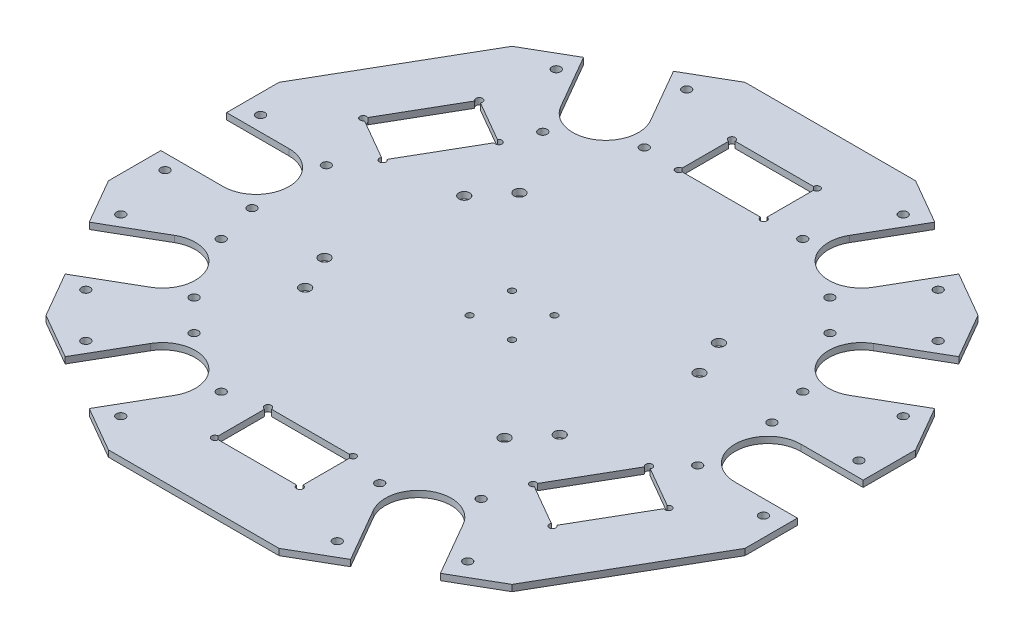
from build123d import *

# Parameters (mm, degrees)
BOSS_EXTRUDE1_DEPTH = 3
SKETCH2_R           = 2.05
HEXCUT1_DEPTH       = 3
SKETCH6_R           = 2.05
QUADCUT1_DEPTH      = 3
CUT_EXTRUDE3_DEPTH  = 3
CUT_EXTRUDE4_DEPTH  = 3
SKETCH10_R          = 2.55
HEXBATHOLES_DEPTH   = 3
SKETCH11_R          = 2.55
QUADBATHOLES_DEPTH  = 3
SKETCH13_R          = 1.55
PDBHOLES_DEPTH      = 3
SKETCH15_R          = 1.55
SKETCH15_W          = 40
SKETCH15_H          = 25
CUT_EXTRUDE8_DEPTH  = 3
ACCESSHOLES_DEPTH   = 3


# Read off the part's stored shape, not the designer's step: AccessHoles
with BuildPart() as part:
    # Sketch1 → Boss-Extrude1 (new body)
    with BuildSketch(Plane(origin=(0, 0, 0), x_dir=(1, 0, 0), z_dir=(0, 1, 0))):
        Polygon((150, -40.192378865), (150, 40.192378865), (109.807621135, 109.807621135), (40.192378865, 150), (-40.192378865, 150), (-109.807621135, 109.807621135), (-150, 40.192378865), (-150, -40.192378865), (-109.807621135, -109.807621135), (-40.192378865, -150), (40.192378865, -150), (109.807621135, -109.807621135), align=None)
    extrude(amount=BOSS_EXTRUDE1_DEPTH)

    # Sketch2 → HexCut1 (cut)
    with BuildSketch(Plane(origin=(0, 3, 0), x_dir=(1, 0, 0), z_dir=(0, 1, 0))):
        with Locations(Location((51.014428415, 133.359581934, 0), (0, 0, 270))):
            Circle(SKETCH2_R)
        with Locations(Location((37.344555434, 99.682667397, 0), (0, 0, 270))):
            Circle(SKETCH2_R)
        with Locations(Location((37.344555434, -99.682667397, 0), (0, 0, 270))):
            Circle(SKETCH2_R)
        with Locations(Location((51.014428415, -133.359581934, 0), (0, 0, 270))):
            Circle(SKETCH2_R)
        with Locations(Location((105, 17.5, 0), (0, 0, 270))):
            Circle(SKETCH2_R)
        with Locations(Location((141, 22.5, 0), (0, 0, 270))):
            Circle(SKETCH2_R)
        with Locations(Location((105, -17.5, 0), (0, 0, 270))):
            Circle(SKETCH2_R)
        with Locations(Location((141, -22.5, 0), (0, 0, 270))):
            Circle(SKETCH2_R)
        with Locations(Location((89.985571585, -110.859581934, 0), (0, 0, 270))):
            Circle(SKETCH2_R)
        with Locations(Location((67.655444566, -82.182667397, 0), (0, 0, 270))):
            Circle(SKETCH2_R)
        with Locations(Location((89.985571585, 110.859581934, 0), (0, 0, 270))):
            Circle(SKETCH2_R)
        with Locations(Location((67.655444566, 82.182667397, 0), (0, 0, 270))):
            Circle(SKETCH2_R)
    hexcut1 = extrude(amount=-HEXCUT1_DEPTH, mode=Mode.SUBTRACT)

    # HexCut2: HexCut1 across plane
    add(hexcut1.mirror(Plane(origin=(0, 0, 0), x_dir=(0, 0, 1), z_dir=(1, 0, 0))), mode=Mode.SUBTRACT)

    # Sketch6 → QuadCut1 (cut)
    with BuildSketch(Plane(origin=(0, 3, 0), x_dir=(1, 0, 0), z_dir=(0, 1, 0))):
        with Locations(Location((99.682667397, 37.344555434, 0), (0, 0, 270))):
            Circle(SKETCH6_R)
        with Locations(Location((133.359581934, 51.014428415, 0), (0, 0, 270))):
            Circle(SKETCH6_R)
        with Locations(Location((110.859581934, 89.985571585, 0), (0, 0, 270))):
            Circle(SKETCH6_R)
        with Locations(Location((82.182667397, 67.655444566, 0), (0, 0, 270))):
            Circle(SKETCH6_R)
    quadcut1 = extrude(amount=-QUADCUT1_DEPTH, mode=Mode.SUBTRACT)

    # Mirror1: QuadCut1 across plane
    add(quadcut1.mirror(Plane(origin=(0, 0, 0), x_dir=(0.5000000000000011, 0, 0.8660254037844378), z_dir=(0.8660254037844379, 0, -0.5000000000000012))), mode=Mode.SUBTRACT)

    # Sketch7 → Cut-Extrude3 (cut)
    with BuildSketch(Plane(origin=(0, 3, 0), x_dir=(1, 0, 0), z_dir=(0, 1, 0))):
        with BuildLine():
            Line((46.876606241, 112.192663696), (84.376606241, 177.14456898))
            Line((84.376606241, 177.14456898), (111.223393759, 161.64456898))
            Line((111.223393759, 161.64456898), (73.723393759, 96.692663696))
            ThreePointArc((73.723393759, 96.692663696), (52.55, 91.019269938), (46.876606241, 112.192663696))
        make_face()
        with BuildLine():
            Line((46.876606241, -112.192663696), (84.376606241, -177.14456898))
            Line((84.376606241, -177.14456898), (111.223393759, -161.64456898))
            Line((111.223393759, -161.64456898), (73.723393759, -96.692663696))
            ThreePointArc((73.723393759, -96.692663696), (52.55, -91.019269938), (46.876606241, -112.192663696))
        make_face()
        with BuildLine():
            Line((120.6, 15.5), (160.6, 15.5))
            Line((160.6, 15.5), (160.6, -15.5))
            Line((160.6, -15.5), (120.6, -15.5))
            ThreePointArc((120.6, -15.5), (105.1, 0), (120.6, 15.5))
        make_face()
    cut_extrude3 = extrude(amount=-CUT_EXTRUDE3_DEPTH, mode=Mode.SUBTRACT)

    # Mirror2: Cut-Extrude3 across plane
    add(cut_extrude3.mirror(Plane(origin=(0, 0, 0), x_dir=(0, 0, 1), z_dir=(1, 0, 0))), mode=Mode.SUBTRACT)

    # Sketch8 → Cut-Extrude4 (cut)
    with BuildSketch(Plane(origin=(0, 3, 0), x_dir=(1, 0, 0), z_dir=(0, 1, 0))):
        with BuildLine():
            Line((96.692663696, 73.723393759), (131.333679848, 93.723393759))
            Line((131.333679848, 93.723393759), (146.833679848, 66.876606241))
            Line((146.833679848, 66.876606241), (112.192663696, 46.876606241))
            ThreePointArc((112.192663696, 46.876606241), (91.019269938, 52.55), (96.692663696, 73.723393759))
        make_face()
    cut_extrude4 = extrude(amount=-CUT_EXTRUDE4_DEPTH, mode=Mode.SUBTRACT)

    # Mirror3: Cut-Extrude4 across plane
    add(cut_extrude4.mirror(Plane(origin=(0, 0, 0), x_dir=(0.5000000000000011, 0, 0.8660254037844378), z_dir=(0.8660254037844379, 0, -0.5000000000000012))), mode=Mode.SUBTRACT)

    # Sketch10 → HexBatHoles (cut)
    with BuildSketch(Plane(origin=(0, 3, 0), x_dir=(1, 0, 0), z_dir=(0, 1, 0))):
        with Locations(Location((60, 37.5, 0), (0, 0, 270))):
            Circle(SKETCH10_R)
        with Locations(Location((60, -37.5, 0), (0, 0, 270))):
            Circle(SKETCH10_R)
        with Locations(Location((-60, 37.5, 0), (0, 0, 270))):
            Circle(SKETCH10_R)
        with Locations(Location((-60, -37.5, 0), (0, 0, 270))):
            Circle(SKETCH10_R)
    extrude(amount=-HEXBATHOLES_DEPTH, mode=Mode.SUBTRACT)

    # Sketch11 → QuadBatHoles (cut)
    with BuildSketch(Plane(origin=(0, 3, 0), x_dir=(1, 0, 0), z_dir=(0, 1, 0))):
        with Locations(Location((67.661263769, 20.69307578, 0), (0, 0, 270))):
            Circle(SKETCH11_R)
        with Locations(Location((48.249835386, -51.751361192, 0), (0, 0, 270))):
            Circle(SKETCH11_R)
        with Locations(Location((-67.661263769, -20.69307578, 0), (0, 0, 270))):
            Circle(SKETCH11_R)
        with Locations(Location((-48.249835386, 51.751361192, 0), (0, 0, 270))):
            Circle(SKETCH11_R)
    extrude(amount=-QUADBATHOLES_DEPTH, mode=Mode.SUBTRACT)

    # Sketch13 → PDBHoles (cut)
    with BuildSketch(Plane(origin=(0, 3, 0), x_dir=(1, 0, 0), z_dir=(0, 1, 0))):
        with Locations(Location((-10, 10, 0), (0, 0, 270))):
            Circle(SKETCH13_R)
        with Locations(Location((10, 10, 0), (0, 0, 270))):
            Circle(SKETCH13_R)
        with Locations(Location((-10, -10, 0), (0, 0, 270))):
            Circle(SKETCH13_R)
        with Locations(Location((10, -10, 0), (0, 0, 270))):
            Circle(SKETCH13_R)
    extrude(amount=-PDBHOLES_DEPTH, mode=Mode.SUBTRACT)

    # Sketch15 → Cut-Extrude8 (cut)
    with BuildSketch(Plane(origin=(0, 3, 0), x_dir=(1, 0, 0), z_dir=(0, 1, 0))):
        with Locations((20, -95)):
            Circle(SKETCH15_R)
        with Locations((-20, -95)):
            Circle(SKETCH15_R)
        with Locations((-20, -120)):
            Circle(SKETCH15_R)
        with Locations((20, -120)):
            Circle(SKETCH15_R)
        with Locations((0, -107.5)):
            Rectangle(SKETCH15_W, SKETCH15_H)
        with BuildLine():
            ThreePointArc((-18.45, -95), (-21.096015511, -93.903984489), (-20, -96.55))
            Line((-20, -96.55), (-20, -95))
            Line((-20, -95), (-18.45, -95))
        make_face()
        with BuildLine():
            Line((-20, -95), (-20, -96.55))
            ThreePointArc((-20, -96.55), (-18.903984489, -96.096015511), (-18.45, -95))
            Line((-18.45, -95), (-20, -95))
        make_face()
        with BuildLine():
            ThreePointArc((18.45, -95), (18.903984489, -96.096015511), (20, -96.55))
            Line((20, -96.55), (20, -95))
            Line((20, -95), (18.45, -95))
        make_face()
        with BuildLine():
            Line((20, -95), (20, -96.55))
            ThreePointArc((20, -96.55), (21.096015511, -96.096015511), (21.55, -95))
            ThreePointArc((21.55, -95), (20, -93.45), (18.45, -95))
            Line((18.45, -95), (20, -95))
        make_face()
        with BuildLine():
            ThreePointArc((20, -118.45), (18.903984489, -118.903984489), (18.45, -120))
            Line((18.45, -120), (20, -120))
            Line((20, -120), (20, -118.45))
        make_face()
        with BuildLine():
            Line((20, -120), (18.45, -120))
            ThreePointArc((18.45, -120), (20, -121.55), (21.55, -120))
            ThreePointArc((21.55, -120), (21.096015511, -118.903984489), (20, -118.45))
            Line((20, -118.45), (20, -120))
        make_face()
        with BuildLine():
            Line((-20, -118.45), (-20, -120))
            Line((-20, -120), (-18.45, -120))
            ThreePointArc((-18.45, -120), (-18.903984489, -118.903984489), (-20, -118.45))
        make_face()
        with BuildLine():
            Line((-18.45, -120), (-20, -120))
            Line((-20, -120), (-20, -118.45))
            ThreePointArc((-20, -118.45), (-21.096015511, -121.096015511), (-18.45, -120))
        make_face()
    extrude(amount=-CUT_EXTRUDE8_DEPTH, mode=Mode.SUBTRACT)

    # AccessHoles outline → AccessHoles (cut)
    with BuildSketch(Plane(origin=(0, 0, 0), x_dir=(1, 0, 0), z_dir=(0, 1, 0))):
        with BuildLine():
            ThreePointArc((-18.45, 123.640367336), (-21.096015511, 124.736382847), (-20, 122.090367336))
            Line((-20, 122.090367336), (-20, 100.190367336))
            ThreePointArc((-20, 100.190367336), (-21.096015511, 97.544351825), (-18.45, 98.640367336))
            Line((-18.45, 98.640367336), (18.45, 98.640367336))
            ThreePointArc((18.45, 98.640367336), (21.096015511, 97.544351825), (20, 100.190367336))
            Line((20, 100.190367336), (20, 122.090367336))
            ThreePointArc((20, 122.090367336), (21.096015511, 124.736382847), (18.45, 123.640367336))
            Line((18.45, 123.640367336), (-18.45, 123.640367336))
        make_face()
        with BuildLine():
            ThreePointArc((114.72437375, -43.111739466), (116.996558781, -41.36823057), (114.157034374, -40.99440009))
            Line((114.157034374, -40.99440009), (95.191078031, -30.04440009))
            ThreePointArc((95.191078031, -30.04440009), (93.447569135, -27.77221506), (93.073738655, -30.611739466))
            Line((93.073738655, -30.611739466), (74.623738655, -62.568076866))
            ThreePointArc((74.623738655, -62.568076866), (72.351553625, -64.311585762), (75.191078031, -64.685416242))
            Line((75.191078031, -64.685416242), (94.157034374, -75.635416242))
            ThreePointArc((94.157034374, -75.635416242), (95.90054327, -77.907601273), (96.27437375, -75.068076866))
            Line((96.27437375, -75.068076866), (114.72437375, -43.111739466))
        make_face()
        with BuildLine():
            ThreePointArc((-74.623738655, 66.208444202), (-72.351553625, 67.951953098), (-75.191078031, 68.325783577))
            Line((-75.191078031, 68.325783577), (-94.157034374, 79.275783577))
            ThreePointArc((-94.157034374, 79.275783577), (-95.900543269, 81.547968608), (-96.27437375, 78.708444202))
            Line((-96.27437375, 78.708444202), (-114.72437375, 46.752106802))
            ThreePointArc((-114.72437375, 46.752106802), (-116.996558781, 45.008597906), (-114.157034374, 44.634767426))
            Line((-114.157034374, 44.634767426), (-95.191078031, 33.684767426))
            ThreePointArc((-95.191078031, 33.684767426), (-93.447569135, 31.412582395), (-93.073738655, 34.252106802))
            Line((-93.073738655, 34.252106802), (-74.623738655, 66.208444202))
        make_face()
    extrude(amount=ACCESSHOLES_DEPTH, mode=Mode.SUBTRACT)


solid = part.part
